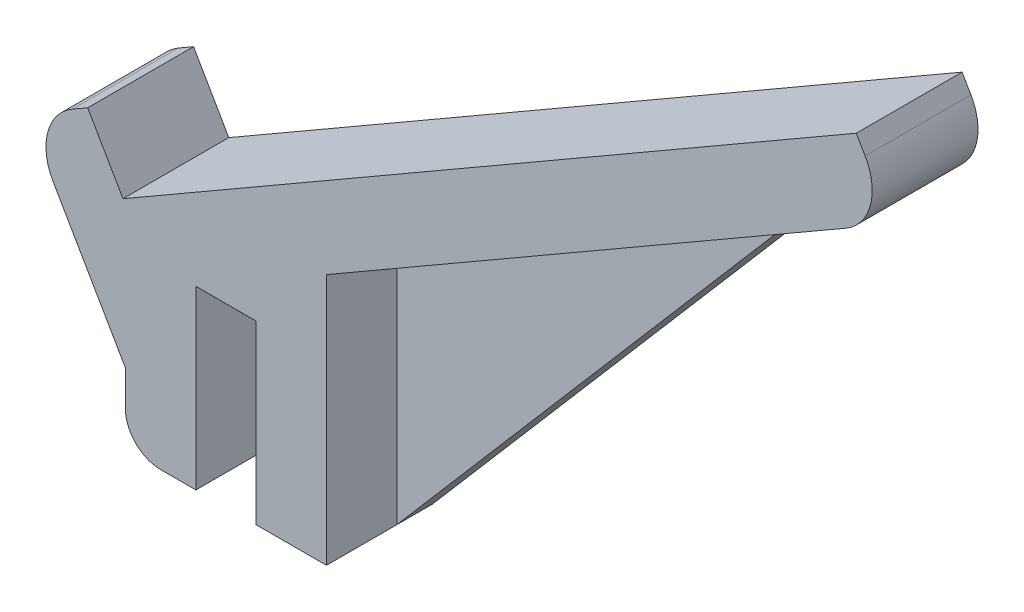
from build123d import *

# Parameters (mm, degrees)
BOSS_EXTRUDE1_DEPTH = 30
BOSS_EXTRUDE2_DEPTH = 10
FILLET1_R           = 15
FILLET2_R           = 10
FILLET3_R           = 15


with BuildPart() as part:
    # Sketch1 → Boss-Extrude1 (new body)
    with BuildSketch(Plane.XY):
        Polygon((0, 0), (0, -50), (20, -50), (20, 21.36195996), (180.176223927, 113.839745962), (170.176223927, 131.160254038), (-37.669872981, 11.160254038), (-47.669872981, 28.480762114), (-64.990381057, 18.480762114), (-37, -30), (-37, -50), (-17, -50), (-17, 0), align=None)
    extrude(amount=BOSS_EXTRUDE1_DEPTH)

    # Sketch2 → Boss-Extrude2 (add)
    with BuildSketch(Plane.XY):
        Polygon((20, -50), (141.485349671, 91.501559295), (20, 21.36195996), align=None)
    extrude(amount=BOSS_EXTRUDE2_DEPTH)

    # Fillet1
    fillet1_edges = [part.edges().sort_by_distance(p)[0] for p in [
        (-64.990381057, 18.480762114, 15),
    ]]
    fillet(fillet1_edges, radius=FILLET1_R)

    # Fillet2
    fillet2_edges = [part.edges().sort_by_distance(p)[0] for p in [
        (-37, -50, 15),
    ]]
    fillet(fillet2_edges, radius=FILLET2_R)

    # Fillet3
    fillet3_edges = [part.edges().sort_by_distance(p)[0] for p in [
        (180.176223927, 113.839745962, 15),
    ]]
    fillet(fillet3_edges, radius=FILLET3_R)


solid = part.part
